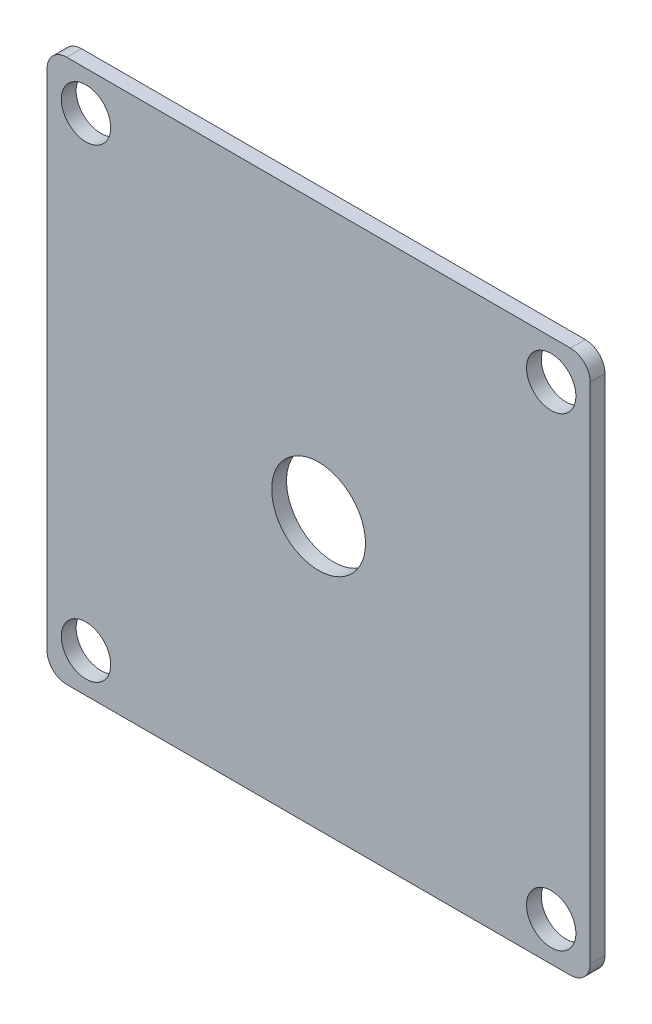
from build123d import *

# Parameters (mm, degrees)
EXTRUDE_1_DEPTH     = 1.5
SKETCH_2_R          = 4.75
CUT_EXTRUDE_1_DEPTH = 78.796208134
SKETCH_3_R          = 2.5
CUT_EXTRUDE_2_DEPTH = 78.796208134


with BuildPart() as part:
    # Эскиз1 → Бобышка-Вытянуть1 (new body)
    with BuildSketch(Plane.XY):
        with BuildLine():
            Line((2, 0), (53, 0))
            ThreePointArc((53, 0), (54.414213562, 0.585786438), (55, 2))
            Line((55, 2), (55, 53))
            ThreePointArc((55, 53), (54.414213562, 54.414213562), (53, 55))
            Line((53, 55), (2, 55))
            ThreePointArc((2, 55), (0.585786438, 54.414213562), (0, 53))
            Line((0, 53), (0, 2))
            ThreePointArc((0, 2), (0.585786438, 0.585786438), (2, 0))
        make_face()
    extrude(amount=EXTRUDE_1_DEPTH)

    # Эскиз2 → Вырез-Вытянуть1 (cut, through all)
    with BuildSketch(Plane.XY.offset(1.5)):
        with Locations((27.5, 27.5)):
            Circle(SKETCH_2_R)
    extrude(amount=-CUT_EXTRUDE_1_DEPTH, mode=Mode.SUBTRACT)

    # Эскиз3 → Вырез-Вытянуть2 (cut, through all)
    with BuildSketch(Plane.XY.offset(1.5)):
        with Locations((3.95, 3.95)):
            Circle(SKETCH_3_R)
        with Locations((51.05, 3.95)):
            Circle(SKETCH_3_R)
        with Locations((51.05, 51.05)):
            Circle(SKETCH_3_R)
        with Locations((3.95, 51.05)):
            Circle(SKETCH_3_R)
    extrude(amount=-CUT_EXTRUDE_2_DEPTH, mode=Mode.SUBTRACT)


solid = part.part
